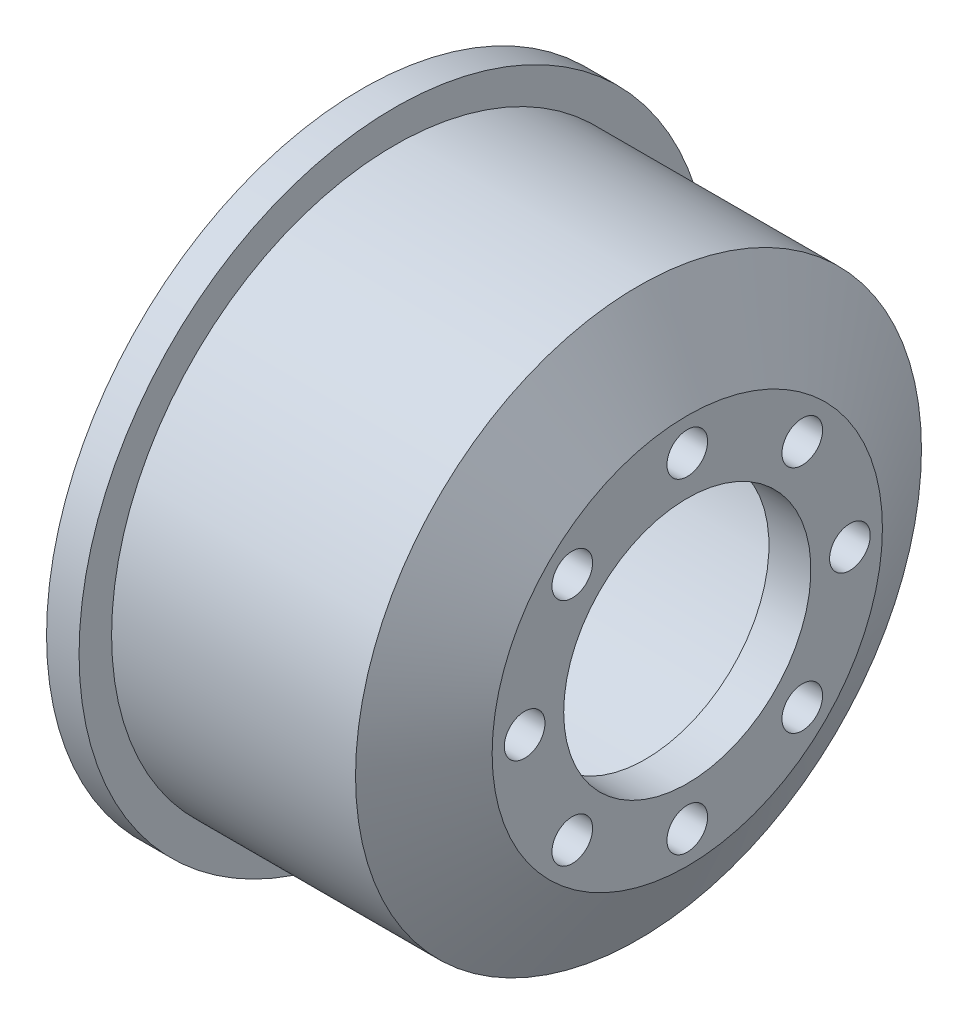
from build123d import *

# Parameters (mm, degrees)
SKETCH11_R         = 1.25
CUT_EXTRUDE9_DEPTH = 34.951730442


with BuildPart() as part:
    # Sketch1 → Revolve1 (revolve)
    with BuildSketch(Plane(origin=(0, 0, 0), x_dir=(1, 0, 0), z_dir=(0, 1, 0))):
        Polygon((12.139813159, 7.6), (12.139813159, 12), (9.139813159, 17.4), (-5.860186841, 17.4), (-5.860186841, 19.4), (-7.360186841, 19.4), (-7.860186841, 19.4), (-7.860186841, 18.4), (-7.360186841, 18.4), (-7.360186841, 16.55), (-7.360186841, 14.55), (8.251305622, 14.55), (9.562997067, 12.188955399), (9.562997067, 7.6), align=None)
    revolve(axis=Axis((-37.278866169, 0, 0), (1, 0, 0)))

    # Sketch11 → Cut-Extrude9 (cut, through all)
    with BuildSketch(Plane(origin=(12.139813159, 0, 0), x_dir=(0, 0, -1), z_dir=(1, 0, 0))):
        with Locations((0, 10)):
            Circle(SKETCH11_R)
        with Locations((7.071067812, 7.071067812)):
            Circle(SKETCH11_R)
        with Locations((10, 0)):
            Circle(SKETCH11_R)
        with Locations((7.071067812, -7.071067812)):
            Circle(SKETCH11_R)
        with Locations((0, -10)):
            Circle(SKETCH11_R)
        with Locations((-7.071067812, -7.071067812)):
            Circle(SKETCH11_R)
        with Locations((-10, 0)):
            Circle(SKETCH11_R)
        with Locations((-7.071067812, 7.071067812)):
            Circle(SKETCH11_R)
    extrude(amount=-CUT_EXTRUDE9_DEPTH, mode=Mode.SUBTRACT)


solid = part.part
